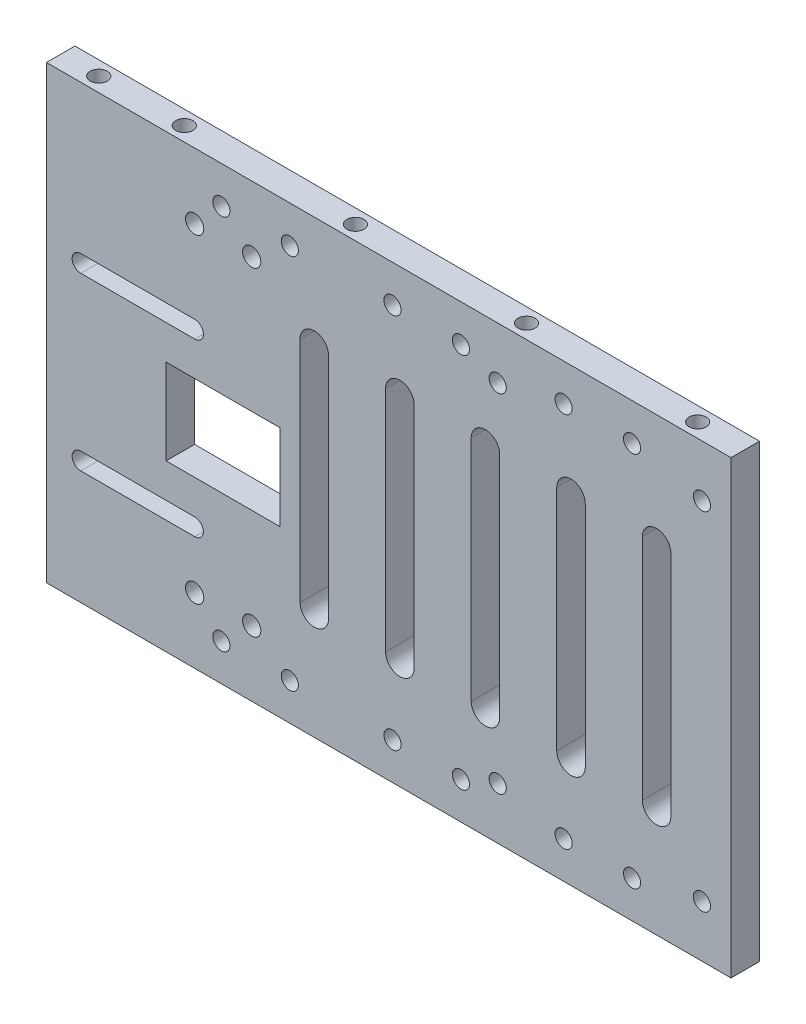
from build123d import *

# Parameters (mm, degrees)
SKETCH_1_W               = 120
SKETCH_1_H               = 79
EXTRUDE_1_DEPTH          = 5
SKETCH_2_R               = 3.1
CUT_EXTRUDE_1_DEPTH      = 2
SKETCH_3_R               = 1.5
CUT_EXTRUDE_2_DEPTH      = 72.897496479
PATTERN_LINEAR_1_COUNT   = 3
PATTERN_LINEAR_1_PITCH   = 30
MIRROR_2_COPY_1_SKETCH_R = 3.1
MIRROR_2_COPY_1_DEPTH    = 2
MIRROR_2_COPY_2_SKETCH_R = 3.1
MIRROR_2_COPY_2_DEPTH    = 2
MIRROR_2_COPY_3_SKETCH_R = 1.5
MIRROR_2_COPY_3_DEPTH    = 72.897496479
MIRROR_2_COPY_4_SKETCH_R = 1.5
MIRROR_2_COPY_4_DEPTH    = 72.897496479
MIRROR_2_COPY_5_SKETCH_R = 3.1
MIRROR_2_COPY_5_DEPTH    = 2
MIRROR_2_COPY_6_SKETCH_R = 1.5
MIRROR_2_COPY_6_DEPTH    = 72.897496479
CUT_EXTRUDE_3_DEPTH      = 1.5
CUT_EXTRUDE_4_DEPTH      = 72.920094549
SKETCH_7_R               = 1.5
CUT_EXTRUDE_6_DEPTH      = 5
SKETCH_9_R               = 1.6
SKETCH_9_R_2             = 1.5
CUT_EXTRUDE_7_DEPTH      = 73.008680032
SKETCH_11_W              = 20
SKETCH_11_H              = 15
CUT_EXTRUDE_8_DEPTH      = 73.008680032


with BuildPart() as part:
    # 草图1 → 凸台-拉伸1 (new body)
    with BuildSketch(Plane.XY):
        Rectangle(SKETCH_1_W, SKETCH_1_H)
    extrude(amount=EXTRUDE_1_DEPTH)

    # 草图2 → 切除-拉伸1 (cut)
    with BuildSketch(Plane(origin=(0, 0, 0), x_dir=(-1, 0, 0), z_dir=(0, 0, -1))):
        with Locations((-42.655984764, -33)):
            Circle(SKETCH_2_R)
        with Locations((-30.655984764, -33)):
            Circle(SKETCH_2_R)
    cut_extrude_1 = extrude(amount=-CUT_EXTRUDE_1_DEPTH, mode=Mode.SUBTRACT)

    # 草图3 → 切除-拉伸2 (cut, through all)
    with BuildSketch(Plane(origin=(0, 0, 2), x_dir=(-1, 0, 0), z_dir=(0, 0, -1))):
        with Locations((-42.655984764, -33)):
            Circle(SKETCH_3_R)
        with Locations((-30.655984764, -33)):
            Circle(SKETCH_3_R)
    cut_extrude_2 = extrude(amount=-CUT_EXTRUDE_2_DEPTH, mode=Mode.SUBTRACT)

    # 阵列(线性)1: 切除-拉伸1, 切除-拉伸2 ×3
    with Locations(*[(-i * PATTERN_LINEAR_1_PITCH, 0, 0) for i in range(1, PATTERN_LINEAR_1_COUNT)]):
        add(cut_extrude_1, mode=Mode.SUBTRACT)
        add(cut_extrude_2, mode=Mode.SUBTRACT)

    # 镜向2 copy 1 sketch → 镜向2 copy 1 (cut)
    with BuildSketch(Plane(origin=(-30, 0, 0), x_dir=(-1, 0, 0), z_dir=(0, 0, -1))):
        with Locations((-42.655984764, 33)):
            Circle(MIRROR_2_COPY_1_SKETCH_R)
        with Locations((-30.655984764, 33)):
            Circle(MIRROR_2_COPY_1_SKETCH_R)
    extrude(amount=-MIRROR_2_COPY_1_DEPTH, mode=Mode.SUBTRACT)

    # 镜向2 copy 2 sketch → 镜向2 copy 2 (cut)
    with BuildSketch(Plane(origin=(-60, 0, 0), x_dir=(-1, 0, 0), z_dir=(0, 0, -1))):
        with Locations((-42.655984764, 33)):
            Circle(MIRROR_2_COPY_2_SKETCH_R)
        with Locations((-30.655984764, 33)):
            Circle(MIRROR_2_COPY_2_SKETCH_R)
    extrude(amount=-MIRROR_2_COPY_2_DEPTH, mode=Mode.SUBTRACT)

    # 镜向2 copy 3 sketch → 镜向2 copy 3 (cut, through all)
    with BuildSketch(Plane(origin=(-30, 0, 2), x_dir=(-1, 0, 0), z_dir=(0, 0, -1))):
        with Locations((-42.655984764, 33)):
            Circle(MIRROR_2_COPY_3_SKETCH_R)
        with Locations((-30.655984764, 33)):
            Circle(MIRROR_2_COPY_3_SKETCH_R)
    extrude(amount=-MIRROR_2_COPY_3_DEPTH, mode=Mode.SUBTRACT)

    # 镜向2 copy 4 sketch → 镜向2 copy 4 (cut, through all)
    with BuildSketch(Plane(origin=(-60, 0, 2), x_dir=(-1, 0, 0), z_dir=(0, 0, -1))):
        with Locations((-42.655984764, 33)):
            Circle(MIRROR_2_COPY_4_SKETCH_R)
        with Locations((-30.655984764, 33)):
            Circle(MIRROR_2_COPY_4_SKETCH_R)
    extrude(amount=-MIRROR_2_COPY_4_DEPTH, mode=Mode.SUBTRACT)

    # 镜向2 copy 5 sketch → 镜向2 copy 5 (cut)
    with BuildSketch(Plane(origin=(0, 0, 0), x_dir=(-1, 0, 0), z_dir=(0, 0, -1))):
        with Locations((-42.655984764, 33)):
            Circle(MIRROR_2_COPY_5_SKETCH_R)
        with Locations((-30.655984764, 33)):
            Circle(MIRROR_2_COPY_5_SKETCH_R)
    extrude(amount=-MIRROR_2_COPY_5_DEPTH, mode=Mode.SUBTRACT)

    # 镜向2 copy 6 sketch → 镜向2 copy 6 (cut, through all)
    with BuildSketch(Plane(origin=(0, 0, 2), x_dir=(-1, 0, 0), z_dir=(0, 0, -1))):
        with Locations((-42.655984764, 33)):
            Circle(MIRROR_2_COPY_6_SKETCH_R)
        with Locations((-30.655984764, 33)):
            Circle(MIRROR_2_COPY_6_SKETCH_R)
    extrude(amount=-MIRROR_2_COPY_6_DEPTH, mode=Mode.SUBTRACT)

    # 草图4 → 切除-拉伸3 (cut)
    with BuildSketch(Plane(origin=(0, 0, 0), x_dir=(-1, 0, 0), z_dir=(0, 0, -1))):
        with BuildLine():
            Line((34, 15.1), (54, 15.1))
            ThreePointArc((54, 15.1), (57.1, 12), (54, 8.9))
            Line((54, 8.9), (34, 8.9))
            ThreePointArc((34, 8.9), (30.9, 12), (34, 15.1))
        make_face()
        with BuildLine():
            Line((34, -23.1), (54, -23.1))
            ThreePointArc((54, -23.1), (57.1, -20), (54, -16.9))
            Line((54, -16.9), (34, -16.9))
            ThreePointArc((34, -16.9), (30.9, -20), (34, -23.1))
        make_face()
    extrude(amount=-CUT_EXTRUDE_3_DEPTH, mode=Mode.SUBTRACT)

    # 草图5 → 切除-拉伸4 (cut, through all)
    with BuildSketch(Plane(origin=(0, 0, 1.5), x_dir=(-1, 0, 0), z_dir=(0, 0, -1))):
        with BuildLine():
            Line((54, 10.5), (34, 10.5))
            ThreePointArc((34, 10.5), (32.5, 12), (34, 13.5))
            Line((34, 13.5), (54, 13.5))
            ThreePointArc((54, 13.5), (55.5, 12), (54, 10.5))
        make_face()
        with BuildLine():
            Line((54, -16.5), (34, -16.5))
            ThreePointArc((34, -16.5), (32.5, -18), (34, -19.5))
            Line((34, -19.5), (54, -19.5))
            ThreePointArc((54, -19.5), (55.5, -18), (54, -16.5))
        make_face()
    extrude(amount=-CUT_EXTRUDE_4_DEPTH, mode=Mode.SUBTRACT)

    # 草图7 → 切除-拉伸6 (cut)
    with BuildSketch(Plane.XZ.offset(39.5)):
        with Locations((51.655984764, 2.5)):
            Circle(SKETCH_7_R)
        with Locations((21.655984764, 2.5)):
            Circle(SKETCH_7_R)
        with Locations((-8.344015236, 2.5)):
            Circle(SKETCH_7_R)
        with Locations((-38.344015236, 2.5)):
            Circle(SKETCH_7_R)
        with Locations((-53.344015236, 2.5)):
            Circle(SKETCH_7_R)
    cut_extrude_6 = extrude(amount=-CUT_EXTRUDE_6_DEPTH, mode=Mode.SUBTRACT)

    # 镜向3: 切除-拉伸6 across plane
    add(cut_extrude_6.mirror(Plane.ZX), mode=Mode.SUBTRACT)

    # 草图9 → 切除-拉伸7 (cut, through all)
    with BuildSketch(Plane(origin=(0, 0, 0), x_dir=(-1, 0, 0), z_dir=(0, 0, -1))):
        with Locations((24.027682272, -28)):
            Circle(SKETCH_9_R)
        with Locations((34.027682272, -28)):
            Circle(SKETCH_9_R)
        with Locations((24.027682272, 28)):
            Circle(SKETCH_9_R)
        with Locations((34.027682272, 28)):
            Circle(SKETCH_9_R)
        with Locations((-19.103783252, 30.4)):
            Circle(SKETCH_9_R_2)
        with Locations((-54.903783252, 30.4)):
            Circle(SKETCH_9_R_2)
        with Locations((-19.103783252, -30.4)):
            Circle(SKETCH_9_R_2)
        with Locations((-54.903783252, -30.4)):
            Circle(SKETCH_9_R_2)
        with BuildLine():
            Line((-49.452559424, -20.266203112), (-49.452559424, 19.733796888))
            ThreePointArc((-49.452559424, 19.733796888), (-46.952559424, 22.233796888), (-44.452559424, 19.733796888))
            Line((-44.452559424, 19.733796888), (-44.452559424, -20.266203112))
            ThreePointArc((-44.452559424, -20.266203112), (-46.952559424, -22.766203112), (-49.452559424, -20.266203112))
        make_face()
        with BuildLine():
            Line((-34.452559424, -20.266203112), (-34.452559424, 19.733796888))
            ThreePointArc((-34.452559424, 19.733796888), (-31.952559424, 22.233796888), (-29.452559424, 19.733796888))
            Line((-29.452559424, 19.733796888), (-29.452559424, -20.266203112))
            ThreePointArc((-29.452559424, -20.266203112), (-31.952559424, -22.766203112), (-34.452559424, -20.266203112))
        make_face()
        with BuildLine():
            Line((-19.452559424, -20.266203112), (-19.452559424, 19.733796888))
            ThreePointArc((-19.452559424, 19.733796888), (-16.952559424, 22.233796888), (-14.452559424, 19.733796888))
            Line((-14.452559424, 19.733796888), (-14.452559424, -20.266203112))
            ThreePointArc((-14.452559424, -20.266203112), (-16.952559424, -22.766203112), (-19.452559424, -20.266203112))
        make_face()
        with BuildLine():
            Line((-4.452559424, -20.266203112), (-4.452559424, 19.733796888))
            ThreePointArc((-4.452559424, 19.733796888), (-1.952559424, 22.233796888), (0.547440576, 19.733796888))
            Line((0.547440576, 19.733796888), (0.547440576, -20.266203112))
            ThreePointArc((0.547440576, -20.266203112), (-1.952559424, -22.766203112), (-4.452559424, -20.266203112))
        make_face()
        with BuildLine():
            Line((10.547440576, -20.266203112), (10.547440576, 19.733796888))
            ThreePointArc((10.547440576, 19.733796888), (13.047440576, 22.233796888), (15.547440576, 19.733796888))
            Line((15.547440576, 19.733796888), (15.547440576, -20.266203112))
            ThreePointArc((15.547440576, -20.266203112), (13.047440576, -22.766203112), (10.547440576, -20.266203112))
        make_face()
    extrude(amount=-CUT_EXTRUDE_7_DEPTH, mode=Mode.SUBTRACT)

    # 草图11 → 切除-拉伸8 (cut, through all)
    with BuildSketch(Plane.XY.offset(5)):
        with Locations((-29.027682272, -3)):
            Rectangle(SKETCH_11_W, SKETCH_11_H)
    extrude(amount=-CUT_EXTRUDE_8_DEPTH, mode=Mode.SUBTRACT)


solid = part.part
